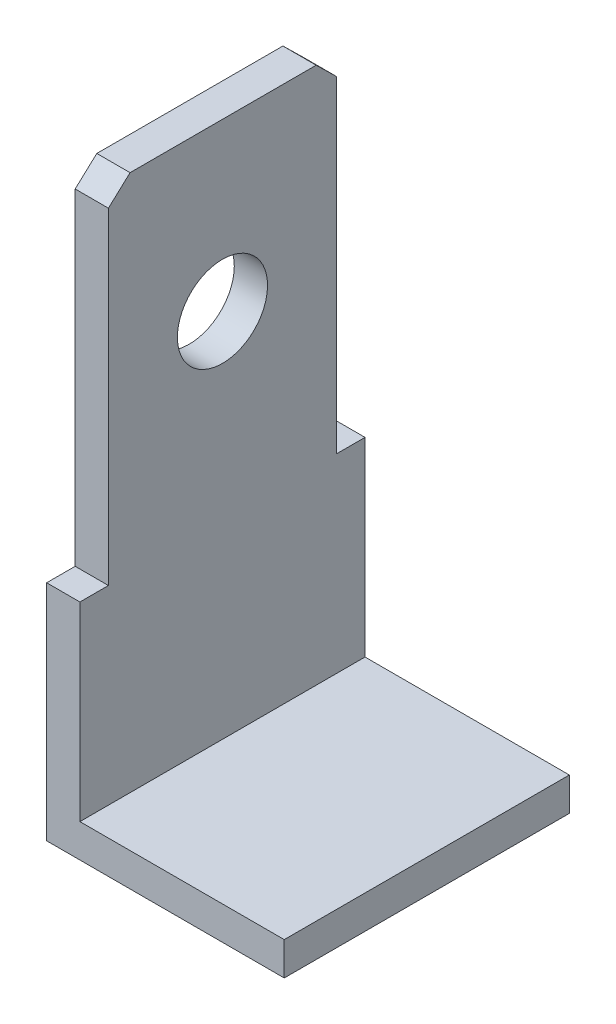
from build123d import *

# Parameters (mm, degrees)
AUFSATZ_LINEAR_AUSTRAGEN1_DEPTH = 6
SKIZZE2_R                       = 0.948914329
SCHNITT_LINEAR_AUSTRAGEN1_DEPTH = 1


with BuildPart() as part:
    # Skizze1 → Aufsatz-Linear austragen1 (new body)
    with BuildSketch(Plane.XY):
        Polygon((0, 0), (0, 12), (0.7, 12), (0.7, 0.7), (5, 0.7), (5, 0), align=None)
    extrude(amount=AUFSATZ_LINEAR_AUSTRAGEN1_DEPTH)

    # Skizze2 → Schnitt-Linear austragen1 (cut)
    with BuildSketch(Plane(origin=(0.7, 0, 0), x_dir=(0, 0, -1), z_dir=(1, 0, 0))):
        with Locations((-3, 8.5)):
            Circle(SKIZZE2_R)
        Polygon((-0.6, 11.580463195), (-0.6, 4.70327223), (0, 4.70327223), (0, 12), (-1.028031399, 12), align=None)
        Polygon((-5.4, 11.580463195), (-5.4, 4.70327223), (-6, 4.70327223), (-6, 12), (-4.944533373, 12), align=None)
    extrude(amount=-SCHNITT_LINEAR_AUSTRAGEN1_DEPTH, mode=Mode.SUBTRACT)


solid = part.part
